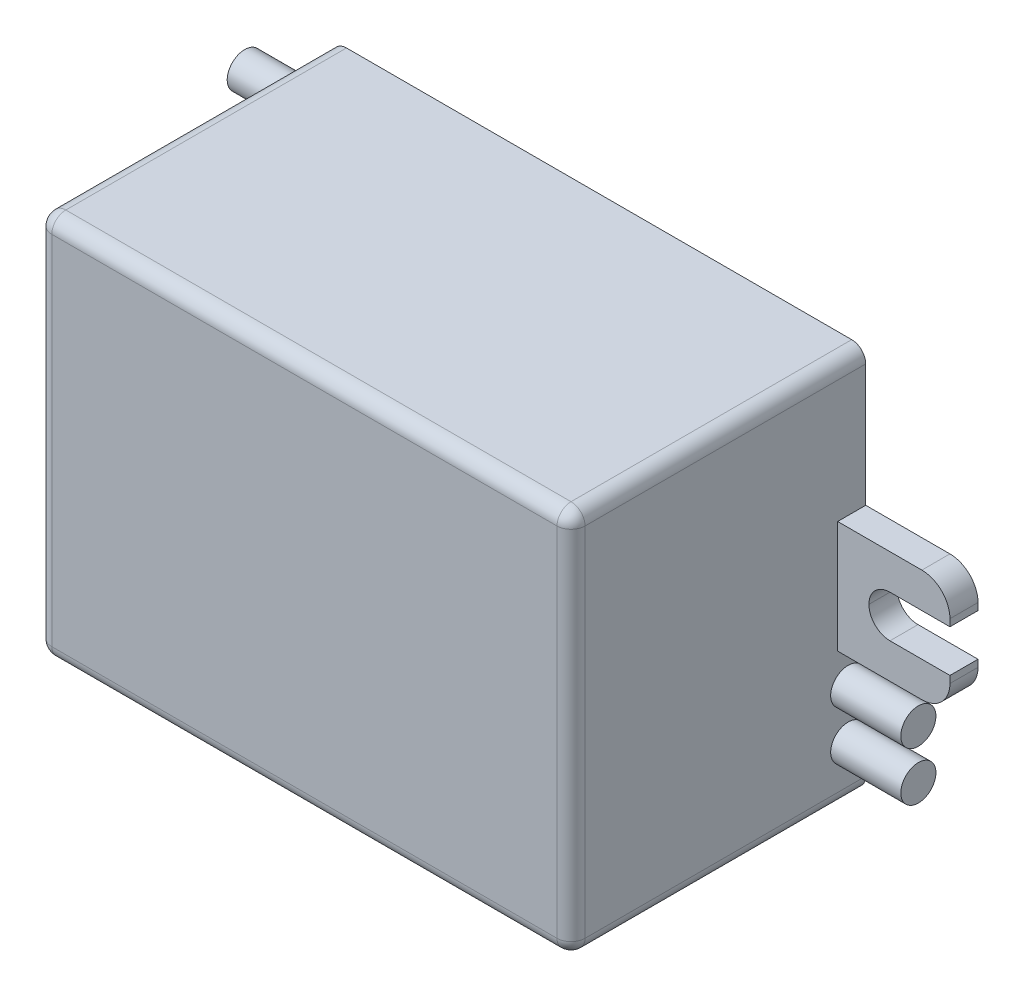
from build123d import *

# Parameters (mm, degrees)
SKETCH1_W            = 38
SKETCH1_H            = 27.444444444
BOSS_EXTRUDE1_DEPTH  = 21
SKETCH2_W            = 8
SKETCH2_H            = 8
BOSS_EXTRUDE2_DEPTH  = 2
SKETCH3_W            = 5.774074058
SKETCH3_H            = 3
CUT_EXTRUDE1_DEPTH   = 2
FILLET1_R            = 2
FILLET2_R            = 1.5
FILLET1_OF_MIRROR1_R = 2
FILLET2_OF_MIRROR1_R = 1.5
SKETCH5_R            = 1.25
BOSS_EXTRUDE3_DEPTH  = 5
SKETCH6_R            = 1.25
BOSS_EXTRUDE4_DEPTH  = 5
FILLET5_R            = 1


with BuildPart() as part:
    # Sketch1 → Boss-Extrude1 (new body)
    with BuildSketch(Plane.XY):
        Rectangle(SKETCH1_W, SKETCH1_H)
    extrude(amount=BOSS_EXTRUDE1_DEPTH)

    # Sketch2 → Boss-Extrude2 (add)
    with BuildSketch(Plane.XY):
        with Locations((-23, 0)):
            Rectangle(SKETCH2_W, SKETCH2_H)
    boss_extrude2 = extrude(amount=BOSS_EXTRUDE2_DEPTH)

    # Sketch3 → Cut-Extrude1 (cut)
    with BuildSketch(Plane.XY.offset(2)):
        with Locations((-24.112962971, 0)):
            Rectangle(SKETCH3_W, SKETCH3_H)
    cut_extrude1 = extrude(amount=-CUT_EXTRUDE1_DEPTH, mode=Mode.SUBTRACT)

    # Fillet1
    fillet1_edges = [part.edges().sort_by_distance(p)[0] for p in [
        (-27, -4, 1),
        (-27, 4, 1),
    ]]
    fillet(fillet1_edges, radius=FILLET1_R)

    # Fillet2
    fillet2_edges = [part.edges().sort_by_distance(p)[0] for p in [
        (-21.225925942, 1.5, 1),
        (-21.225925942, -1.5, 1),
    ]]
    fillet(fillet2_edges, radius=FILLET2_R - 0.0001)  # a hair under: the kernel refuses the full size

    # Mirror1: Boss-Extrude2, Cut-Extrude1 across plane
    add(boss_extrude2.mirror(Plane(origin=(0, 0, 0), x_dir=(0, 0, 1), z_dir=(1, 0, 0))))
    add(cut_extrude1.mirror(Plane(origin=(0, 0, 0), x_dir=(0, 0, 1), z_dir=(1, 0, 0))), mode=Mode.SUBTRACT)

    # Fillet1 of Mirror1
    fillet1_of_mirror1_edges = [part.edges().sort_by_distance(p)[0] for p in [
        (27, -4, 1),
        (27, 4, 1),
    ]]
    fillet(fillet1_of_mirror1_edges, radius=FILLET1_OF_MIRROR1_R)

    # Fillet2 of Mirror1
    fillet2_of_mirror1_edges = [part.edges().sort_by_distance(p)[0] for p in [
        (21.225925942, 1.5, 1),
        (21.225925942, -1.5, 1),
    ]]
    fillet(fillet2_of_mirror1_edges, radius=FILLET2_OF_MIRROR1_R - 0.0001)  # a hair under: the kernel refuses the full size

    # Sketch5 → Boss-Extrude3 (add)
    with BuildSketch(Plane.ZY.offset(19)):
        with Locations(Location((1.25, 10, 0), (0, 0, 180))):
            Circle(SKETCH5_R)
        with Locations(Location((1.25, 6.5, 0), (0, 0, 180))):
            Circle(SKETCH5_R)
    extrude(amount=BOSS_EXTRUDE3_DEPTH)

    # Sketch6 → Boss-Extrude4 (add)
    with BuildSketch(Plane(origin=(19, 0, 0), x_dir=(0, 0, -1), z_dir=(1, 0, 0))):
        with Locations((-1.25, -6.5)):
            Circle(SKETCH6_R)
        with Locations((-1.25, -10)):
            Circle(SKETCH6_R)
    extrude(amount=BOSS_EXTRUDE4_DEPTH)

    # Fillet5
    fillet5_edges = [part.edges().sort_by_distance(p)[0] for p in [
        (19, 13.722222222, 10.5),
        (19, -13.722222222, 10.5),
        (-19, -13.722222222, 10.5),
        (-19, 13.722222222, 10.5),
        (19, 0, 21),
        (0, -13.722222222, 21),
        (-19, 0, 21),
        (0, 13.722222222, 21),
    ]]
    fillet(fillet5_edges, radius=FILLET5_R)


solid = part.part
